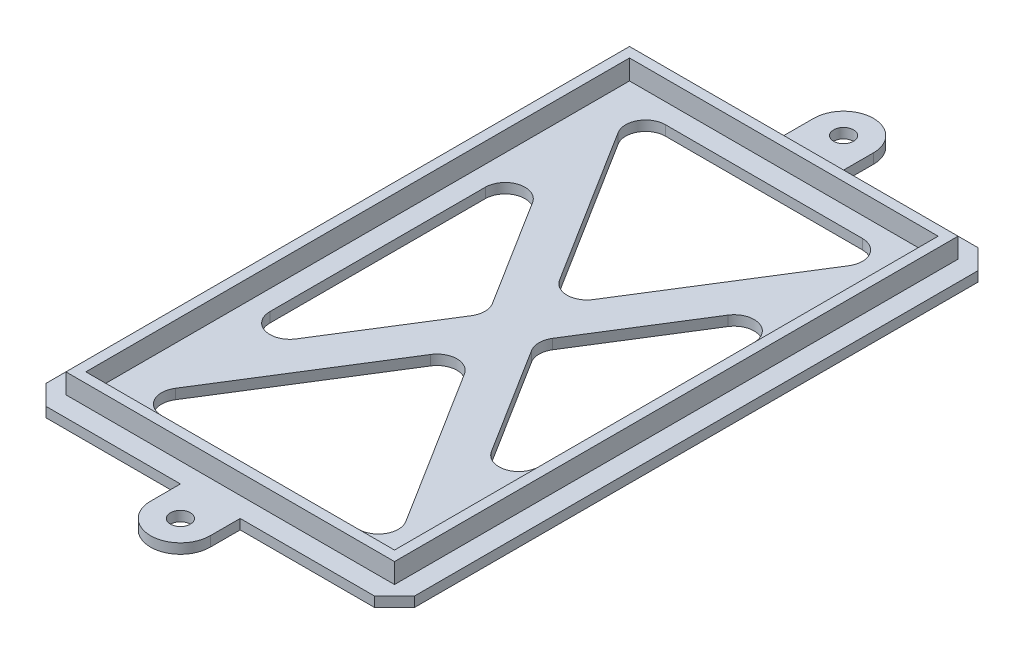
from build123d import *

# Parameters (mm, degrees)
SKETCH1_W           = 41.91
SKETCH1_H           = 71.882
SKETCH1_W_2         = 39.37
SKETCH1_H_2         = 69.342
BOSS_EXTRUDE4_DEPTH = 2.54
SKETCH5_W           = 46.99
SKETCH5_H           = 76.962
BOSS_EXTRUDE5_DEPTH = 1.27
CHAMFER4_SIZE       = 2.54
CUT_EXTRUDE1_DEPTH  = 2.54
FILLET1_R           = 2.54
SKETCH7_R           = 1.27
BOSS_EXTRUDE6_DEPTH = 1.27


with BuildPart() as part:
    # Sketch1 → Boss-Extrude4 (new body)
    with BuildSketch(Plane(origin=(0, 0, 0), x_dir=(1, 0, 0), z_dir=(0, 1, 0))):
        with Locations((-19.685, -34.671)):
            Rectangle(SKETCH1_W, SKETCH1_H)
        with Locations((-19.685, -34.671)):
            Rectangle(SKETCH1_W_2, SKETCH1_H_2, mode=Mode.SUBTRACT)
    extrude(amount=BOSS_EXTRUDE4_DEPTH)

    # Sketch5 → Boss-Extrude5 (add)
    with BuildSketch(Plane.XZ):
        with Locations((-19.685, 34.671)):
            Rectangle(SKETCH5_W, SKETCH5_H)
    extrude(amount=BOSS_EXTRUDE5_DEPTH)

    # Chamfer4
    chamfer4_edges = [part.edges().sort_by_distance(p)[0] for p in [
        (-43.18, -0.635, 73.152),
        (3.81, -0.635, 73.152),
        (3.81, -0.635, -3.81),
        (-43.18, -0.635, -3.81),
    ]]
    chamfer(chamfer4_edges, length=CHAMFER4_SIZE)

    # Sketch6 → Cut-Extrude1 (cut)
    with BuildSketch(Plane(origin=(0, 0, 0), x_dir=(1, 0, 0), z_dir=(0, 1, 0))):
        Polygon((-36.83, -2.54), (-2.54, -2.54), (-19.685, -29.888964801), align=None)
        Polygon((-36.83, -12.104070398), (-36.83, -57.237929602), (-22.68284632, -34.671), align=None)
        Polygon((-36.83, -66.802), (-2.54, -66.802), (-19.685, -39.453035199), align=None)
        Polygon((-2.54, -12.104070398), (-2.54, -57.237929602), (-16.68715368, -34.671), align=None)
    extrude(amount=-CUT_EXTRUDE1_DEPTH, mode=Mode.SUBTRACT)

    # Fillet1
    fillet1_edges = [part.edges().sort_by_distance(p)[0] for p in [
        (-19.685, -0.635, 39.453035199),
        (-36.83, -0.635, 66.802),
        (-2.54, -0.635, 57.237929602),
        (-2.54, -0.635, 12.104070398),
        (-16.68715368, -0.635, 34.671),
        (-22.68284632, -0.635, 34.671),
        (-19.685, -0.635, 29.888964801),
        (-2.54, -0.635, 2.54),
        (-36.83, -0.635, 12.104070398),
        (-2.54, -0.635, 66.802),
        (-36.83, -0.635, 57.237929602),
        (-36.83, -0.635, 2.54),
    ]]
    fillet(fillet1_edges, radius=FILLET1_R)

    # Sketch7 → Boss-Extrude6 (add)
    # profile 1 of 2: a face of its own
    with BuildSketch(Plane(origin=(0, 0, 0), x_dir=(1, 0, 0), z_dir=(0, 1, 0))):
        with BuildLine():
            Line((-15.875, 7.62), (-15.875, 3.81))
            Line((-15.875, 3.81), (-23.495, 3.81))
            Line((-23.495, 3.81), (-23.495, 7.62))
            ThreePointArc((-23.495, 7.62), (-19.685, 11.43), (-15.875, 7.62))
        make_face()
        with Locations((-19.685, 7.62)):
            Circle(SKETCH7_R, mode=Mode.SUBTRACT)
    # profile 2 of 2: a face of its own
    with BuildSketch(Plane(origin=(0, 0, 0), x_dir=(1, 0, 0), z_dir=(0, 1, 0))):
        with BuildLine():
            Line((-23.495, -73.152), (-23.495, -76.962))
            ThreePointArc((-23.495, -76.962), (-19.685, -80.772), (-15.875, -76.962))
            Line((-15.875, -76.962), (-15.875, -73.152))
            Line((-15.875, -73.152), (-23.495, -73.152))
        make_face()
        with Locations((-19.685, -76.962)):
            Circle(SKETCH7_R, mode=Mode.SUBTRACT)
    extrude(amount=-BOSS_EXTRUDE6_DEPTH)


solid = part.part
